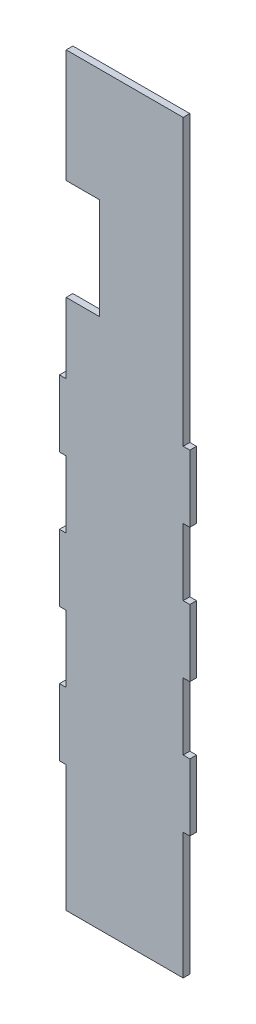
from build123d import *

# Parameters (mm, degrees)
EXTRUDE_2_DEPTH = 2


with BuildPart() as part:
    # 草图1 → 凸台-拉伸2 (new body)
    with BuildSketch(Plane.XY):
        Polygon((-8, 15.14100393), (-8, 49), (27, 49), (27, -36.22154055), (29, -36.22154055), (29, -56.22154055), (27, -56.22154055), (27, -76.22154055), (29, -76.22154055), (29, -96.22154055), (27, -96.22154055), (27, -116.22154055), (29, -116.22154055), (29, -136.22154055), (27, -136.22154055), (27, -174), (-8, -174), (-8, -136.22154055), (-10, -136.22154055), (-10, -116.22154055), (-8, -116.22154055), (-8, -96.22154055), (-10, -96.22154055), (-10, -76.22154055), (-8, -76.22154055), (-8, -56.22154055), (-10, -56.22154055), (-10, -36.22154055), (-8, -36.22154055), (-8, -15.14100393), (2, -15.14100393), (2, 15.14100393), align=None)
    extrude(amount=EXTRUDE_2_DEPTH)


solid = part.part
